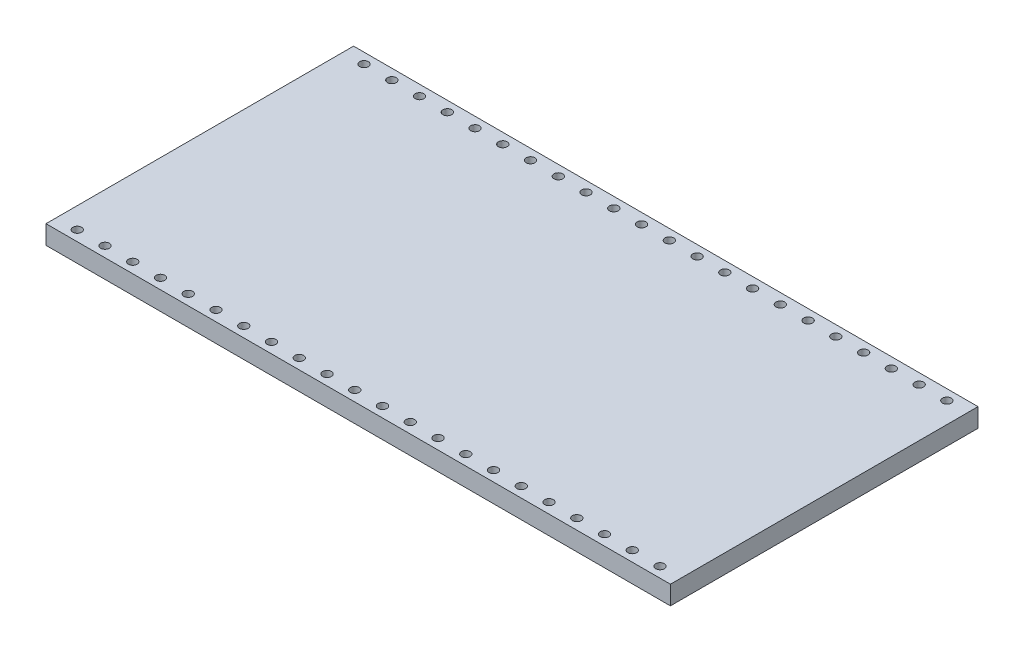
from build123d import *

# Parameters (mm, degrees)
SKETCH1_W                = 57.15
SKETCH1_H                = 28.15
BOSS_EXTRUDE1_DEPTH      = 1.72
SKETCH2_R                = 0.4
CUT_EXTRUDE1_DEPTH       = 32.899759403
LPATTERN1_COUNT          = 22
LPATTERN1_PITCH          = 2.54
MIRROR1_COPY_1_SKETCH_R  = 0.4
MIRROR1_COPY_1_DEPTH     = 32.899759403
MIRROR1_COPY_2_SKETCH_R  = 0.4
MIRROR1_COPY_2_DEPTH     = 32.899759403
MIRROR1_COPY_3_SKETCH_R  = 0.4
MIRROR1_COPY_3_DEPTH     = 32.899759403
MIRROR1_COPY_4_SKETCH_R  = 0.4
MIRROR1_COPY_4_DEPTH     = 32.899759403
MIRROR1_COPY_5_SKETCH_R  = 0.4
MIRROR1_COPY_5_DEPTH     = 32.899759403
MIRROR1_COPY_6_SKETCH_R  = 0.4
MIRROR1_COPY_6_DEPTH     = 32.899759403
MIRROR1_COPY_7_SKETCH_R  = 0.4
MIRROR1_COPY_7_DEPTH     = 32.899759403
MIRROR1_COPY_8_SKETCH_R  = 0.4
MIRROR1_COPY_8_DEPTH     = 32.899759403
MIRROR1_COPY_9_SKETCH_R  = 0.4
MIRROR1_COPY_9_DEPTH     = 32.899759403
MIRROR1_COPY_10_SKETCH_R = 0.4
MIRROR1_COPY_10_DEPTH    = 32.899759403
MIRROR1_COPY_11_SKETCH_R = 0.4
MIRROR1_COPY_11_DEPTH    = 32.899759403
MIRROR1_COPY_12_SKETCH_R = 0.4
MIRROR1_COPY_12_DEPTH    = 32.899759403
MIRROR1_COPY_13_SKETCH_R = 0.4
MIRROR1_COPY_13_DEPTH    = 32.899759403
MIRROR1_COPY_14_SKETCH_R = 0.4
MIRROR1_COPY_14_DEPTH    = 32.899759403
MIRROR1_COPY_15_SKETCH_R = 0.4
MIRROR1_COPY_15_DEPTH    = 32.899759403
MIRROR1_COPY_16_SKETCH_R = 0.4
MIRROR1_COPY_16_DEPTH    = 32.899759403
MIRROR1_COPY_17_SKETCH_R = 0.4
MIRROR1_COPY_17_DEPTH    = 32.899759403
MIRROR1_COPY_18_SKETCH_R = 0.4
MIRROR1_COPY_18_DEPTH    = 32.899759403
MIRROR1_COPY_19_SKETCH_R = 0.4
MIRROR1_COPY_19_DEPTH    = 32.899759403
MIRROR1_COPY_20_SKETCH_R = 0.4
MIRROR1_COPY_20_DEPTH    = 32.899759403
MIRROR1_COPY_21_SKETCH_R = 0.4
MIRROR1_COPY_21_DEPTH    = 32.899759403
MIRROR1_COPY_22_SKETCH_R = 0.4
MIRROR1_COPY_22_DEPTH    = 32.899759403


with BuildPart() as part:
    # Sketch1 → Boss-Extrude1 (new body)
    with BuildSketch(Plane(origin=(0, 0, 0), x_dir=(1, 0, 0), z_dir=(0, 1, 0))):
        Rectangle(SKETCH1_W, SKETCH1_H)
    extrude(amount=BOSS_EXTRUDE1_DEPTH)

    # Sketch2 → Cut-Extrude1 (cut, through all)
    with BuildSketch(Plane(origin=(0, 1.72, 0), x_dir=(1, 0, 0), z_dir=(0, 1, 0))):
        with Locations((26.675, 13.125)):
            Circle(SKETCH2_R)
    cut_extrude1 = extrude(amount=-CUT_EXTRUDE1_DEPTH, mode=Mode.SUBTRACT)

    # LPattern1: Cut-Extrude1 ×22
    with Locations(*[(-i * LPATTERN1_PITCH, 0, 0) for i in range(1, LPATTERN1_COUNT)]):
        add(cut_extrude1, mode=Mode.SUBTRACT)

    # Mirror1 copy 1 sketch → Mirror1 copy 1 (cut, through all)
    with BuildSketch(Plane(origin=(-2.54, 1.72, 0), x_dir=(1, 0, 0), z_dir=(0, 1, 0))):
        with Locations((26.675, -13.125)):
            Circle(MIRROR1_COPY_1_SKETCH_R)
    extrude(amount=-MIRROR1_COPY_1_DEPTH, mode=Mode.SUBTRACT)

    # Mirror1 copy 2 sketch → Mirror1 copy 2 (cut, through all)
    with BuildSketch(Plane(origin=(-5.08, 1.72, 0), x_dir=(1, 0, 0), z_dir=(0, 1, 0))):
        with Locations((26.675, -13.125)):
            Circle(MIRROR1_COPY_2_SKETCH_R)
    extrude(amount=-MIRROR1_COPY_2_DEPTH, mode=Mode.SUBTRACT)

    # Mirror1 copy 3 sketch → Mirror1 copy 3 (cut, through all)
    with BuildSketch(Plane(origin=(-7.62, 1.72, 0), x_dir=(1, 0, 0), z_dir=(0, 1, 0))):
        with Locations((26.675, -13.125)):
            Circle(MIRROR1_COPY_3_SKETCH_R)
    extrude(amount=-MIRROR1_COPY_3_DEPTH, mode=Mode.SUBTRACT)

    # Mirror1 copy 4 sketch → Mirror1 copy 4 (cut, through all)
    with BuildSketch(Plane(origin=(-10.16, 1.72, 0), x_dir=(1, 0, 0), z_dir=(0, 1, 0))):
        with Locations((26.675, -13.125)):
            Circle(MIRROR1_COPY_4_SKETCH_R)
    extrude(amount=-MIRROR1_COPY_4_DEPTH, mode=Mode.SUBTRACT)

    # Mirror1 copy 5 sketch → Mirror1 copy 5 (cut, through all)
    with BuildSketch(Plane(origin=(-12.7, 1.72, 0), x_dir=(1, 0, 0), z_dir=(0, 1, 0))):
        with Locations((26.675, -13.125)):
            Circle(MIRROR1_COPY_5_SKETCH_R)
    extrude(amount=-MIRROR1_COPY_5_DEPTH, mode=Mode.SUBTRACT)

    # Mirror1 copy 6 sketch → Mirror1 copy 6 (cut, through all)
    with BuildSketch(Plane(origin=(-15.24, 1.72, 0), x_dir=(1, 0, 0), z_dir=(0, 1, 0))):
        with Locations((26.675, -13.125)):
            Circle(MIRROR1_COPY_6_SKETCH_R)
    extrude(amount=-MIRROR1_COPY_6_DEPTH, mode=Mode.SUBTRACT)

    # Mirror1 copy 7 sketch → Mirror1 copy 7 (cut, through all)
    with BuildSketch(Plane(origin=(-17.78, 1.72, 0), x_dir=(1, 0, 0), z_dir=(0, 1, 0))):
        with Locations((26.675, -13.125)):
            Circle(MIRROR1_COPY_7_SKETCH_R)
    extrude(amount=-MIRROR1_COPY_7_DEPTH, mode=Mode.SUBTRACT)

    # Mirror1 copy 8 sketch → Mirror1 copy 8 (cut, through all)
    with BuildSketch(Plane(origin=(-20.32, 1.72, 0), x_dir=(1, 0, 0), z_dir=(0, 1, 0))):
        with Locations((26.675, -13.125)):
            Circle(MIRROR1_COPY_8_SKETCH_R)
    extrude(amount=-MIRROR1_COPY_8_DEPTH, mode=Mode.SUBTRACT)

    # Mirror1 copy 9 sketch → Mirror1 copy 9 (cut, through all)
    with BuildSketch(Plane(origin=(-22.86, 1.72, 0), x_dir=(1, 0, 0), z_dir=(0, 1, 0))):
        with Locations((26.675, -13.125)):
            Circle(MIRROR1_COPY_9_SKETCH_R)
    extrude(amount=-MIRROR1_COPY_9_DEPTH, mode=Mode.SUBTRACT)

    # Mirror1 copy 10 sketch → Mirror1 copy 10 (cut, through all)
    with BuildSketch(Plane(origin=(-25.4, 1.72, 0), x_dir=(1, 0, 0), z_dir=(0, 1, 0))):
        with Locations((26.675, -13.125)):
            Circle(MIRROR1_COPY_10_SKETCH_R)
    extrude(amount=-MIRROR1_COPY_10_DEPTH, mode=Mode.SUBTRACT)

    # Mirror1 copy 11 sketch → Mirror1 copy 11 (cut, through all)
    with BuildSketch(Plane(origin=(-27.94, 1.72, 0), x_dir=(1, 0, 0), z_dir=(0, 1, 0))):
        with Locations((26.675, -13.125)):
            Circle(MIRROR1_COPY_11_SKETCH_R)
    extrude(amount=-MIRROR1_COPY_11_DEPTH, mode=Mode.SUBTRACT)

    # Mirror1 copy 12 sketch → Mirror1 copy 12 (cut, through all)
    with BuildSketch(Plane(origin=(-30.48, 1.72, 0), x_dir=(1, 0, 0), z_dir=(0, 1, 0))):
        with Locations((26.675, -13.125)):
            Circle(MIRROR1_COPY_12_SKETCH_R)
    extrude(amount=-MIRROR1_COPY_12_DEPTH, mode=Mode.SUBTRACT)

    # Mirror1 copy 13 sketch → Mirror1 copy 13 (cut, through all)
    with BuildSketch(Plane(origin=(-33.02, 1.72, 0), x_dir=(1, 0, 0), z_dir=(0, 1, 0))):
        with Locations((26.675, -13.125)):
            Circle(MIRROR1_COPY_13_SKETCH_R)
    extrude(amount=-MIRROR1_COPY_13_DEPTH, mode=Mode.SUBTRACT)

    # Mirror1 copy 14 sketch → Mirror1 copy 14 (cut, through all)
    with BuildSketch(Plane(origin=(-35.56, 1.72, 0), x_dir=(1, 0, 0), z_dir=(0, 1, 0))):
        with Locations((26.675, -13.125)):
            Circle(MIRROR1_COPY_14_SKETCH_R)
    extrude(amount=-MIRROR1_COPY_14_DEPTH, mode=Mode.SUBTRACT)

    # Mirror1 copy 15 sketch → Mirror1 copy 15 (cut, through all)
    with BuildSketch(Plane(origin=(-38.1, 1.72, 0), x_dir=(1, 0, 0), z_dir=(0, 1, 0))):
        with Locations((26.675, -13.125)):
            Circle(MIRROR1_COPY_15_SKETCH_R)
    extrude(amount=-MIRROR1_COPY_15_DEPTH, mode=Mode.SUBTRACT)

    # Mirror1 copy 16 sketch → Mirror1 copy 16 (cut, through all)
    with BuildSketch(Plane(origin=(-40.64, 1.72, 0), x_dir=(1, 0, 0), z_dir=(0, 1, 0))):
        with Locations((26.675, -13.125)):
            Circle(MIRROR1_COPY_16_SKETCH_R)
    extrude(amount=-MIRROR1_COPY_16_DEPTH, mode=Mode.SUBTRACT)

    # Mirror1 copy 17 sketch → Mirror1 copy 17 (cut, through all)
    with BuildSketch(Plane(origin=(-43.18, 1.72, 0), x_dir=(1, 0, 0), z_dir=(0, 1, 0))):
        with Locations((26.675, -13.125)):
            Circle(MIRROR1_COPY_17_SKETCH_R)
    extrude(amount=-MIRROR1_COPY_17_DEPTH, mode=Mode.SUBTRACT)

    # Mirror1 copy 18 sketch → Mirror1 copy 18 (cut, through all)
    with BuildSketch(Plane(origin=(-45.72, 1.72, 0), x_dir=(1, 0, 0), z_dir=(0, 1, 0))):
        with Locations((26.675, -13.125)):
            Circle(MIRROR1_COPY_18_SKETCH_R)
    extrude(amount=-MIRROR1_COPY_18_DEPTH, mode=Mode.SUBTRACT)

    # Mirror1 copy 19 sketch → Mirror1 copy 19 (cut, through all)
    with BuildSketch(Plane(origin=(-48.26, 1.72, 0), x_dir=(1, 0, 0), z_dir=(0, 1, 0))):
        with Locations((26.675, -13.125)):
            Circle(MIRROR1_COPY_19_SKETCH_R)
    extrude(amount=-MIRROR1_COPY_19_DEPTH, mode=Mode.SUBTRACT)

    # Mirror1 copy 20 sketch → Mirror1 copy 20 (cut, through all)
    with BuildSketch(Plane(origin=(-50.8, 1.72, 0), x_dir=(1, 0, 0), z_dir=(0, 1, 0))):
        with Locations((26.675, -13.125)):
            Circle(MIRROR1_COPY_20_SKETCH_R)
    extrude(amount=-MIRROR1_COPY_20_DEPTH, mode=Mode.SUBTRACT)

    # Mirror1 copy 21 sketch → Mirror1 copy 21 (cut, through all)
    with BuildSketch(Plane(origin=(-53.34, 1.72, 0), x_dir=(1, 0, 0), z_dir=(0, 1, 0))):
        with Locations((26.675, -13.125)):
            Circle(MIRROR1_COPY_21_SKETCH_R)
    extrude(amount=-MIRROR1_COPY_21_DEPTH, mode=Mode.SUBTRACT)

    # Mirror1 copy 22 sketch → Mirror1 copy 22 (cut, through all)
    with BuildSketch(Plane(origin=(0, 1.72, 0), x_dir=(1, 0, 0), z_dir=(0, 1, 0))):
        with Locations((26.675, -13.125)):
            Circle(MIRROR1_COPY_22_SKETCH_R)
    extrude(amount=-MIRROR1_COPY_22_DEPTH, mode=Mode.SUBTRACT)


solid = part.part
